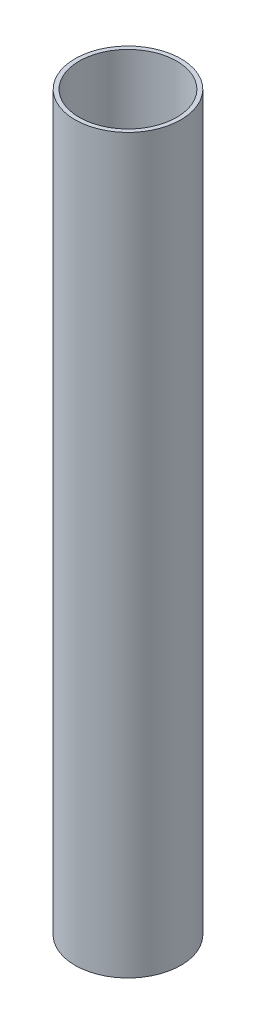
from build123d import *

# Parameters (mm, degrees)
SKETCH1_R           = 15.9
SKETCH1_R_2         = 14.65
BOSS_EXTRUDE1_DEPTH = 220


with BuildPart() as part:
    # Sketch1 → Boss-Extrude1 (new body)
    with BuildSketch(Plane(origin=(0, 0, 0), x_dir=(1, 0, 0), z_dir=(0, 1, 0))):
        Circle(SKETCH1_R)
        Circle(SKETCH1_R_2, mode=Mode.SUBTRACT)
    extrude(amount=BOSS_EXTRUDE1_DEPTH)


solid = part.part
